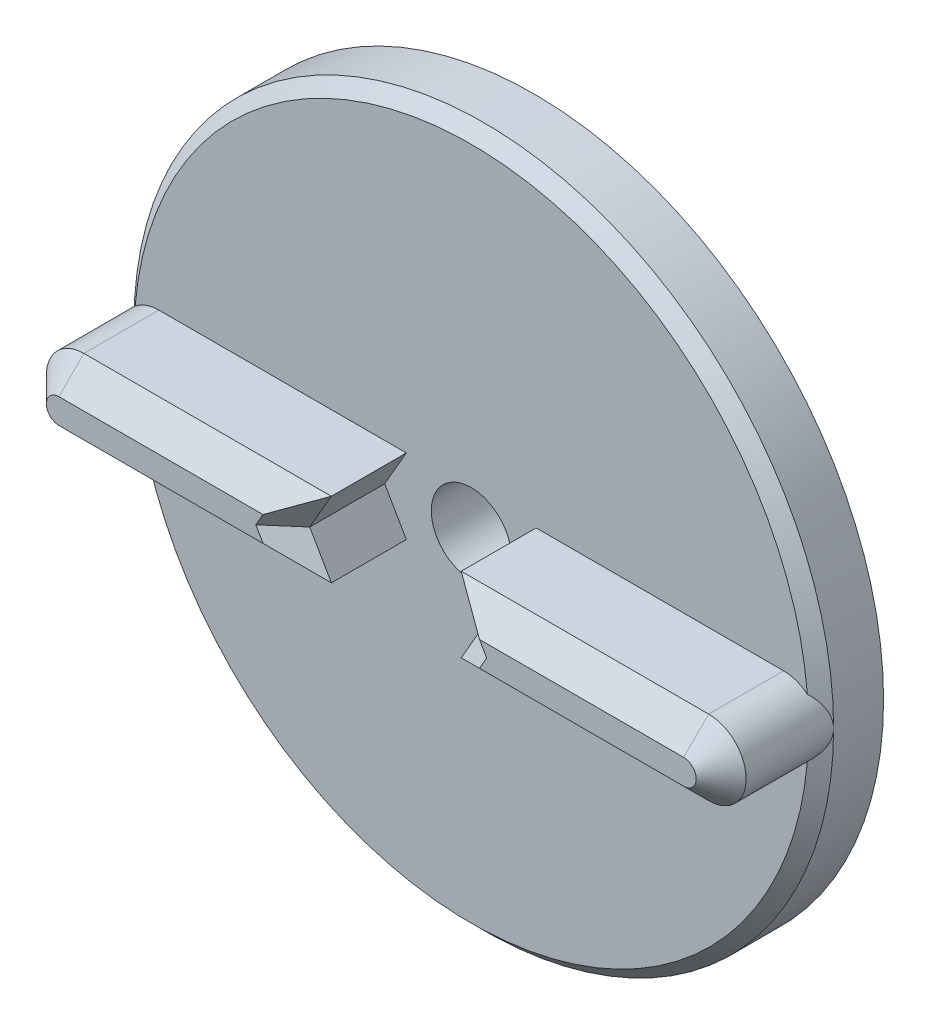
from build123d import *

# Parameters (mm, degrees)
SKETCH_1_R               = 14
EXTRUDE_1_DEPTH          = 2.5
EXTRUDE_2_DEPTH          = 4
CHAMFER_1_SIZE           = 0.5
SKETCH_5_W               = 8.8
SKETCH_5_H               = 2.8
EXTRUDE_3_DEPTH          = 2
CUT_EXTRUDE_4_DEPTH      = 2.5
CUT_EXTRUDE_4_DEPTH_BACK = 21.83866615
SKETCH_3_R               = 1.6
CUT_EXTRUDE_5_DEPTH      = 4
CHAMFER_2_SIZE           = 1


with BuildPart() as part:
    # ｽｹｯﾁ1 → ﾎﾞｽ - 押し出し1 (new body)
    with BuildSketch(Plane.XY):
        Circle(SKETCH_1_R)
    extrude(amount=EXTRUDE_1_DEPTH)

    # ｽｹｯﾁ2 → ﾎﾞｽ - 押し出し2 (add)
    with BuildSketch(Plane.XY.offset(2.5)):
        with BuildLine():
            Line((-12.5, 1.5), (12.5, 1.5))
            ThreePointArc((12.5, 1.5), (14, 0), (12.5, -1.5))
            Line((12.5, -1.5), (-12.5, -1.5))
            ThreePointArc((-12.5, -1.5), (-14, 0), (-12.5, 1.5))
        make_face()
    extrude(amount=EXTRUDE_2_DEPTH)

    # 面取り1
    # the kernel refuses this chamfer: 0.5 mm, written as the material it takes off along each edge
    with BuildSketch(Plane(origin=(0, 0, 2.5), x_dir=(1, 0, 0), z_dir=(0, -1, 0))) as chamfer_1_piece_1_section:
        Polygon((14, -CHAMFER_1_SIZE), (14 - CHAMFER_1_SIZE, 0), (14, 0), align=None)
    chamfer_1_piece_1 = revolve(axis=Axis((0, 0, 2.5), (0, 0, 1)), revolution_arc=180, mode=Mode.PRIVATE)
    chamfer_1_piece_1 = chamfer_1_piece_1 - Plane(origin=(-12.5, 0, 2.262706396), x_dir=(0, -1, 0), z_dir=(0, 0, -1)) * Cylinder(1.5, 56, mode=Mode.PRIVATE)
    chamfer_1_piece_1 = chamfer_1_piece_1 - Plane(origin=(12.5, 0, 2.262706396), x_dir=(0, 1, 0), z_dir=(0, 0, -1)) * Cylinder(1.5, 56, mode=Mode.PRIVATE)
    add(chamfer_1_piece_1, mode=Mode.SUBTRACT)
    with BuildSketch(Plane(origin=(0, 0, 2.5), x_dir=(-1, 0, 0), z_dir=(0, 1, 0))) as chamfer_1_piece_2_section:
        Polygon((14, -CHAMFER_1_SIZE), (14 - CHAMFER_1_SIZE, 0), (14, 0), align=None)
    chamfer_1_piece_2 = revolve(axis=Axis((0, 0, 2.5), (0, 0, 1)), revolution_arc=180, mode=Mode.PRIVATE)
    chamfer_1_piece_2 = chamfer_1_piece_2 - Plane(origin=(-12.5, 0, 2.262706396), x_dir=(0, -1, 0), z_dir=(0, 0, -1)) * Cylinder(1.5, 56, mode=Mode.PRIVATE)
    chamfer_1_piece_2 = chamfer_1_piece_2 - Plane(origin=(12.5, 0, 2.262706396), x_dir=(0, 1, 0), z_dir=(0, 0, -1)) * Cylinder(1.5, 56, mode=Mode.PRIVATE)
    add(chamfer_1_piece_2, mode=Mode.SUBTRACT)

    # ｽｹｯﾁ5 → ﾎﾞｽ - 押し出し3 (add)
    with BuildSketch(Plane(origin=(0, 0, 0), x_dir=(-1, 0, 0), z_dir=(0, 0, -1))):
        Rectangle(SKETCH_5_W, SKETCH_5_H)
    extrude(amount=EXTRUDE_3_DEPTH)

    # ｽｹｯﾁ3 → ｶｯﾄ - 押し出し4 (cut, two sides: drawn at the far end of the back side and taken through both)
    with BuildSketch(Plane(origin=(0, 0, 0), x_dir=(-1, 0, 0), z_dir=(0, 0, -1)).offset(-CUT_EXTRUDE_4_DEPTH_BACK)):
        with Locations(Location((0, 0, 0), (0, 0, 241.044975628))):
            Circle(SKETCH_3_R)
    extrude(amount=CUT_EXTRUDE_4_DEPTH + CUT_EXTRUDE_4_DEPTH_BACK, mode=Mode.SUBTRACT)

    # ｽｹｯﾁ6 → ｶｯﾄ - 押し出し5 (cut)
    with BuildSketch(Plane.XY.offset(6.5)):
        Polygon((3.464101615, 0), (1.732050808, 3), (-1.732050808, 3), (-3.464101615, 0), (-1.732050808, -3), (1.732050808, -3), align=None)
    extrude(amount=-CUT_EXTRUDE_5_DEPTH, mode=Mode.SUBTRACT)

    # 面取り2
    chamfer_2_edges = [part.edges().sort_by_distance(p)[0] for p in [
        (-14, 0, 6.5),
        (-7.549038106, -1.5, 6.5),
        (14, 0, 6.5),
        (7.549038106, 1.5, 6.5),
        (7.549038106, -1.5, 6.5),
        (-7.549038106, 1.5, 6.5),
        (-3.031088913, -0.75, 6.5),
        (-3.031088913, 0.75, 6.5),
        (3.031088913, -0.75, 6.5),
        (3.031088913, 0.75, 6.5),
    ]]
    chamfer(chamfer_2_edges, length=CHAMFER_2_SIZE)


solid = part.part
